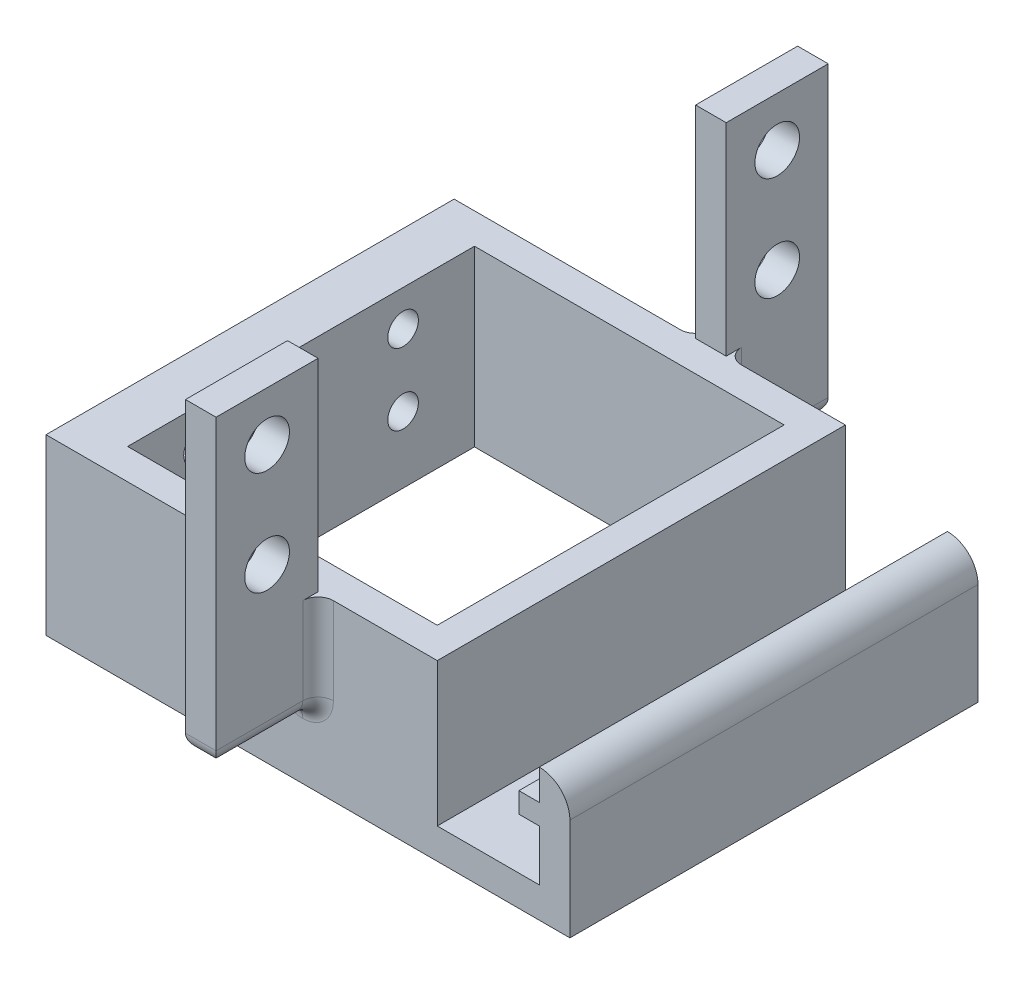
from build123d import *

# Parameters (mm, degrees)
SKETCH1_W           = 40
SKETCH1_H           = 3
BOSS_EXTRUDE1_DEPTH = 51.35
SKETCH2_W           = 3
SKETCH2_H           = 40
BOSS_EXTRUDE2_DEPTH = 10
FILLET1_R           = 3
SKETCH3_W           = 40
SKETCH3_H           = 2
BOSS_EXTRUDE3_DEPTH = 2
SKETCH4_W           = 30.35
SKETCH4_H           = 34
BOSS_EXTRUDE4_DEPTH = 14.04
SKETCH5_W           = 3
SKETCH5_H           = 29.82
BOSS_EXTRUDE5_DEPTH = 10
FILLET3_R           = 1.5
SKETCH6_R           = 2.19
CUT_EXTRUDE1_DEPTH  = 68.601394216
CUT_EXTRUDE2_REACH  = 82.595
SKETCH7_R           = 1.5
SKETCH8_W           = 30.35
SKETCH8_H           = 34
CUT_EXTRUDE3_DEPTH  = 3


with BuildPart() as part:
    # Sketch1 → Boss-Extrude1 (new body)
    with BuildSketch(Plane(origin=(0, 0, 0), x_dir=(0, 0, -1), z_dir=(1, 0, 0))):
        with Locations((20, 1.5)):
            Rectangle(SKETCH1_W, SKETCH1_H)
    extrude(amount=BOSS_EXTRUDE1_DEPTH)

    # Sketch2 → Boss-Extrude2 (add)
    with BuildSketch(Plane(origin=(0, 3, 0), x_dir=(1, 0, 0), z_dir=(0, 1, 0))):
        with Locations((49.85, 20)):
            Rectangle(SKETCH2_W, SKETCH2_H)
    extrude(amount=BOSS_EXTRUDE2_DEPTH)

    # Fillet1
    fillet1_edges = [part.edges().sort_by_distance(p)[0] for p in [
        (51.35, 13, -20),
    ]]
    fillet(fillet1_edges, radius=FILLET1_R - 0.0001)  # a hair under: the kernel refuses the full size

    # Sketch3 → Boss-Extrude3 (add)
    with BuildSketch(Plane.ZY.offset(-48.35)):
        with Locations((-20, 9)):
            Rectangle(SKETCH3_W, SKETCH3_H)
    extrude(amount=BOSS_EXTRUDE3_DEPTH)

    # Sketch4 → Boss-Extrude4 (add)
    with BuildSketch(Plane(origin=(0, 3, 0), x_dir=(1, 0, 0), z_dir=(0, 1, 0))):
        Polygon((0, 40), (3, 40), (38.35, 40), (38.35, 37), (38.35, 3), (38.35, 0), (3, 0), (0, 0), align=None)
        with Locations((20.175, 20)):
            Rectangle(SKETCH4_W, SKETCH4_H, mode=Mode.SUBTRACT)
    extrude(amount=BOSS_EXTRUDE4_DEPTH)

    # Sketch5 → Boss-Extrude5 (add)
    with BuildSketch(Plane.XY):
        with Locations((25.17, 21.95)):
            Rectangle(SKETCH5_W, SKETCH5_H)
    boss_extrude5 = extrude(amount=BOSS_EXTRUDE5_DEPTH)

    # Mirror2: Boss-Extrude5 across plane
    add(boss_extrude5.mirror(Plane(origin=(0, 0, -20), x_dir=(1, 0, 0), z_dir=(0, 0, -1))))

    # Fillet3
    fillet3_edges = [part.edges().sort_by_distance(p)[0] for p in [
        (23.67, 12.04, 0),
        (25.17, 7.04, 0),
        (23.67, 7.04, 5),
        (26.67, 12.04, 0),
        (26.67, 7.04, 5),
        (25.17, 7.04, 10),
        (23.67, 12.04, -40),
        (23.67, 7.04, -45),
        (25.17, 7.04, -50),
        (26.67, 7.04, -45),
        (26.67, 12.04, -40),
        (25.17, 7.04, -40),
    ]]
    fillet(fillet3_edges, radius=FILLET3_R - 0.0001)  # a hair under: the kernel refuses the full size

    # Sketch6 → Cut-Extrude1 (cut, through all)
    with BuildSketch(Plane(origin=(26.67, 0, 0), x_dir=(0, 0, -1), z_dir=(1, 0, 0))):
        with Locations((-5, 32.035)):
            Circle(SKETCH6_R)
        with Locations((-5, 21.865)):
            Circle(SKETCH6_R)
    cut_extrude1 = extrude(amount=-CUT_EXTRUDE1_DEPTH, mode=Mode.SUBTRACT)

    # Mirror3: Cut-Extrude1 across plane
    add(cut_extrude1.mirror(Plane(origin=(0, 0, -20), x_dir=(1, 0, 0), z_dir=(0, 0, -1))), mode=Mode.SUBTRACT)

    # Sketch7 → Cut-Extrude2 (cut, up to next)
    with BuildSketch(Plane.ZY, mode=Mode.PRIVATE) as cut_extrude2_sk1:
        with Locations((-10, 13.52)):
            Circle(SKETCH7_R)
    cut_extrude2_tool1 = extrude(cut_extrude2_sk1.sketch, amount=-CUT_EXTRUDE2_REACH, mode=Mode.PRIVATE) & part.part
    # Sketch7 → Cut-Extrude2 (cut, up to next)
    with BuildSketch(Plane.ZY, mode=Mode.PRIVATE) as cut_extrude2_sk2:
        with Locations((-10, 6.52)):
            Circle(SKETCH7_R)
    cut_extrude2_tool2 = extrude(cut_extrude2_sk2.sketch, amount=-CUT_EXTRUDE2_REACH, mode=Mode.PRIVATE) & part.part
    cut_extrude2_1 = cut_extrude2_tool1.solids().sort_by_distance((0, 13.52, -10))[0]
    add(cut_extrude2_1, mode=Mode.SUBTRACT)
    cut_extrude2_2 = cut_extrude2_tool2.solids().sort_by_distance((0, 6.52, -10))[0]
    add(cut_extrude2_2, mode=Mode.SUBTRACT)
    cut_extrude2 = cut_extrude2_1 + cut_extrude2_2  # Cut-Extrude2 as one shape, for the pattern or mirror that repeats it

    # Mirror4: Cut-Extrude2 across plane
    add(cut_extrude2.mirror(Plane(origin=(0, 0, -20), x_dir=(1, 0, 0), z_dir=(0, 0, -1))), mode=Mode.SUBTRACT)

    # Sketch8 → Cut-Extrude3 (cut)
    with BuildSketch(Plane(origin=(0, 3, 0), x_dir=(1, 0, 0), z_dir=(0, 1, 0))):
        with Locations((20.175, 20)):
            Rectangle(SKETCH8_W, SKETCH8_H)
    extrude(amount=-CUT_EXTRUDE3_DEPTH, mode=Mode.SUBTRACT)


solid = part.part
